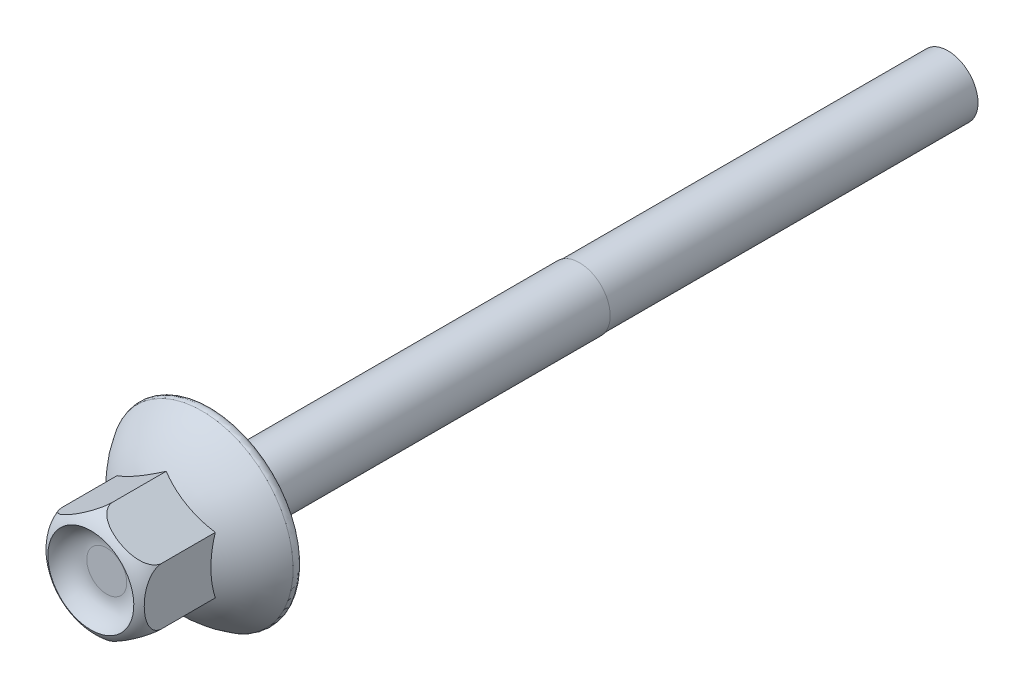
from build123d import *

# Parameters (mm, degrees)
HEAD_DEPTH     = 10
SHANK_SKETCH_R = 2.5
SHANK_DEPTH    = 60
SKETCH6_R      = 3.5
HEAD_CUT_DEPTH = 1.5
FILLET1_R      = 2
FILLET2_R      = 0.5
THREAD_END_W   = 30
THREAD_END_H   = 0.05


with BuildPart() as part:
    # Head Sketch → Head (new body)
    with BuildSketch(Plane.XY):
        Polygon((0, 4.618802154), (4, 2.309401077), (4, -2.309401077), (0, -4.618802154), (-4, -2.309401077), (-4, 2.309401077), align=None)
    extrude(amount=HEAD_DEPTH)

    # Shank Sketch → Shank (add)
    with BuildSketch(Plane.XY):
        Circle(SHANK_SKETCH_R)
    extrude(amount=-SHANK_DEPTH)

    # Sketch3 → Flange (revolve)
    with BuildSketch(Plane(origin=(0, 0, 0), x_dir=(-1, 0, 0), z_dir=(0, 1, 0)), mode=Mode.PRIVATE) as flange_sk:
        with BuildLine():
            Line((-7, 0), (0, 0))
            Line((0, 0), (0, 5))
            ThreePointArc((0, 5), (-4.279198343, 3.863597101), (-7.430769231, 0.753846154))
            ThreePointArc((-7.430769231, 0.753846154), (-7.434121571, 0.251930531), (-7, 0))
        make_face()
    revolve(flange_sk.sketch.rotate(Axis((0, 0, 0), (0, 0, 1)), 30), axis=Axis((0, 0, 0), (0, 0, 1)))

    # Sketch5 → Head Trim (revolve, cut)
    with BuildSketch(Plane(origin=(0, 0, 0), x_dir=(0, 0, -1), z_dir=(1, 0, 0)), mode=Mode.PRIVATE) as head_trim_sk:
        with BuildLine():
            Line((-10, -2.618802154), (-10, -4.618802154))
            Line((-10, -4.618802154), (-8, -4.618802154))
            ThreePointArc((-8, -4.618802154), (-9.414213562, -4.033015716), (-10, -2.618802154))
        make_face()
    revolve(head_trim_sk.sketch.rotate(Axis((0, 0, 15.085599173), (0, 0, -1)), 90), axis=Axis((0, 0, 15.085599173), (0, 0, -1)), mode=Mode.SUBTRACT)

    # Sketch6 → Head Cut (cut)
    with BuildSketch(Plane.XY.offset(10)):
        Circle(SKETCH6_R)
    extrude(amount=-HEAD_CUT_DEPTH, mode=Mode.SUBTRACT)

    # Fillet1
    # the kernel refuses this fillet: 2 mm, written as the material it adds along each edge
    with BuildSketch(Plane(origin=(0, 0, 8.5), x_dir=(1, 0, 0), z_dir=(0, -1, 0))) as fillet1_piece_1:
        with BuildLine():
            CenterArc((1.62822269, 2), FILLET1_R, 270, 69.372190804)
            Line((1.62822269, 0), (3.5, 0))
            Line((3.5, 0), (3.5, 1.295408131))
        make_face()
    revolve(axis=Axis((0, 0, 8.5), (0, 0, 1)), revolution_arc=180.000001341)
    with BuildSketch(Plane(origin=(0, 0, 8.5), x_dir=(-0.9999999999999998, -2.340668935307113e-08, 0), z_dir=(-2.340668935307113e-08, 0.9999999999999998, 0))) as fillet1_piece_2:
        with BuildLine():
            CenterArc((1.62822269, 2), FILLET1_R, 270, 69.372190804)
            Line((1.62822269, 0), (3.5, 0))
            Line((3.5, 0), (3.5, 1.295408131))
        make_face()
    revolve(axis=Axis((0, 0, 8.5), (0, 0, 1)), revolution_arc=179.999998659)

    # Fillet2
    fillet2_edges = [part.edges().sort_by_distance(p)[0] for p in [
        (-2.5, 0, 0),
    ]]
    fillet(fillet2_edges, radius=FILLET2_R)

    # Thread End → Thread Cut (revolve, cut)
    with BuildSketch(Plane(origin=(0, 0, 0), x_dir=(0, 0, -1), z_dir=(1, 0, 0)), mode=Mode.PRIVATE) as thread_cut_sk:
        with Locations((45, 2.475)):
            Rectangle(THREAD_END_W, THREAD_END_H)
    revolve(thread_cut_sk.sketch.rotate(Axis((0, 0, -21.551935625), (0, 0, -1)), 270), axis=Axis((0, 0, -21.551935625), (0, 0, -1)), mode=Mode.SUBTRACT)


solid = part.part
